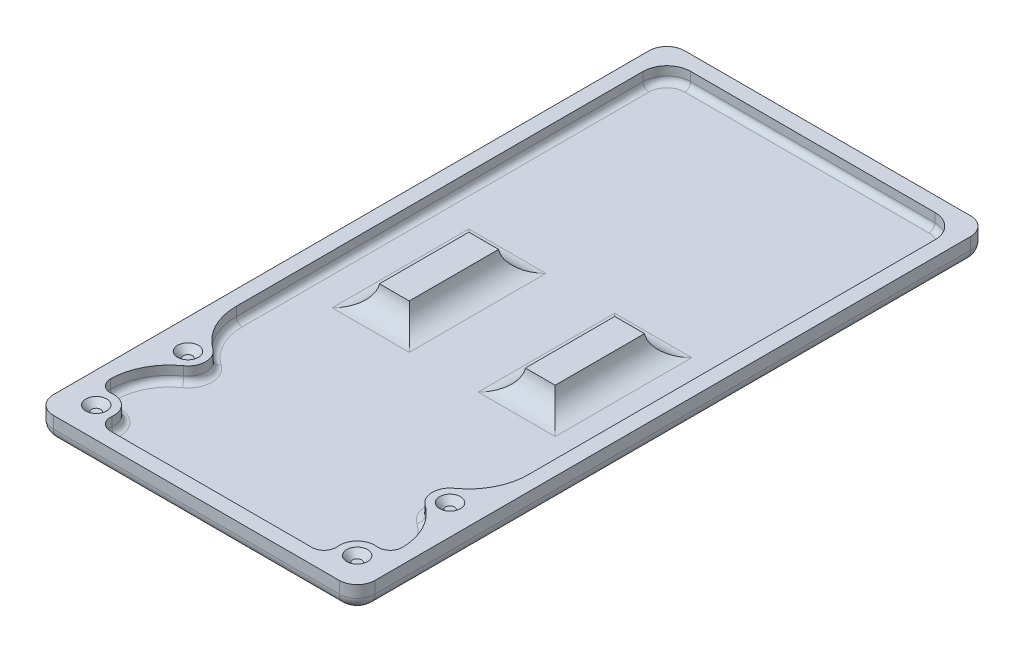
from build123d import *

# Parameters (mm, degrees)
SKETCH1_W            = 49
SKETCH1_H            = 101
BOSS_EXTRUDE1_DEPTH  = 1.5
SKETCH2_W            = 54
SKETCH2_H            = 106
SKETCH2_W_2          = 49
SKETCH2_H_2          = 101
BOSS_EXTRUDE2_DEPTH  = 4
BOSS_EXTRUDE3_DEPTH  = 4
SKETCH8_W            = 5
SKETCH8_H            = 15
BOSS_EXTRUDE4_DEPTH  = 3.5
FILLET3_R            = 4
FILLET3_OF_MIRROR1_R = 4
SKETCH4_R            = 1.75
CUT_EXTRUDE1_DEPTH   = 1
SKETCH5_R            = 1.75
CUT_EXTRUDE2_DEPTH   = 1
FILLET1_R            = 3
FILLET2_R            = 10
CHAMFER1_SIZE        = 1
CHAMFER2_SIZE        = 1
FILLET4_R            = 2
FILLET6_R            = 4
FILLET5_R            = 1
FILLET7_R            = 2


# Some blends are built 0.0001 mm under size
with BuildPart() as part:
    # Sketch1 → Boss-Extrude1 (new body)
    with BuildSketch(Plane(origin=(0, 0, 0), x_dir=(1, 0, 0), z_dir=(0, 1, 0))):
        Rectangle(SKETCH1_W, SKETCH1_H)
    extrude(amount=BOSS_EXTRUDE1_DEPTH)

    # Sketch2 → Boss-Extrude2 (add)
    with BuildSketch(Plane(origin=(0, 0, 0), x_dir=(1, 0, 0), z_dir=(0, 1, 0))):
        Rectangle(SKETCH2_W, SKETCH2_H)
        Rectangle(SKETCH2_W_2, SKETCH2_H_2, mode=Mode.SUBTRACT)
    extrude(amount=BOSS_EXTRUDE2_DEPTH)

    # Sketch3 → Boss-Extrude3 (add)
    with BuildSketch(Plane(origin=(0, 0, 0), x_dir=(1, 0, 0), z_dir=(0, 1, 0))):
        with BuildLine():
            Line((-24.5, -30.741687605), (-24.5, -34.058312395))
            ThreePointArc((-24.5, -34.058312395), (-19, -32.4), (-24.5, -30.741687605))
        make_face()
        with BuildLine():
            Line((-24.5, -46.403337045), (-24.5, -50.5))
            Line((-24.5, -50.5), (-20.403337045, -50.5))
            ThreePointArc((-20.403337045, -50.5), (-19.778679656, -45.778679656), (-24.5, -46.403337045))
        make_face()
    boss_extrude3 = extrude(amount=BOSS_EXTRUDE3_DEPTH)

    # Sketch8 → Boss-Extrude4 (add)
    with BuildSketch(Plane(origin=(0, 1.5, 0), x_dir=(1, 0, 0), z_dir=(0, 1, 0))):
        with Locations((-12.25, 0)):
            Rectangle(SKETCH8_W, SKETCH8_H)
    boss_extrude4 = extrude(amount=BOSS_EXTRUDE4_DEPTH)

    # Fillet3
    # the kernel refuses this fillet: 4 mm, written as the material it adds along each edge
    with BuildSketch(Plane(origin=(-14.75, 1.5, -7.5), x_dir=(0, 0, -1), z_dir=(1, 0, 0)), Plane(origin=(-9.75, 1.5, 7.5), x_dir=(0, 0, 1), z_dir=(-1, 0, 0))) as fillet3_piece_1:
        with BuildLine():
            CenterArc((3.968626967, 4), FILLET3_R, 187.180755781, 82.819244219)
            Line((0, 3.5), (-0.079372539, 3.49))
            ThreePointArc((-0.079372539, 3.49), (-0.08, 1.75), (-0.08, 0))
            Line((-0.08, 0), (0, -0.08))
            Line((0, -0.08), (3.968626967, -0.08))
            Line((3.968626967, -0.08), (3.968626967, 0))
        make_face()
    extrude(amount=5)
    with BuildSketch(Plane(origin=(-9.75, 1.5, -7.5), x_dir=(1, 0, 0), z_dir=(0, 0, 1)), Plane(origin=(-14.75, 1.5, 7.5), x_dir=(-1, 0, 0), z_dir=(0, 0, -1))) as fillet3_piece_2:
        with BuildLine():
            CenterArc((3.968626967, 4), FILLET3_R, 187.180755781, 82.819244219)
            Line((0, 3.5), (-0.079372539, 3.49))
            ThreePointArc((-0.079372539, 3.49), (-0.08, 1.75), (-0.08, 0))
            Line((-0.08, 0), (0, -0.08))
            Line((0, -0.08), (3.968626967, -0.08))
            Line((3.968626967, -0.08), (3.968626967, 0))
        make_face()
    extrude(amount=15)
    with BuildSketch(Plane(origin=(-14.75, 1.5, 7.5), x_dir=(-1, 0, 0), z_dir=(0, 0, -1))) as fillet3_piece_3a_section:
        with BuildLine():
            CenterArc((3.968626967, 4), FILLET3_R, 187.180755781, 82.819244219)
            Line((0, 3.5), (-0.079372539, 3.49))
            ThreePointArc((-0.079372539, 3.49), (-0.08, 1.75), (-0.08, 0))
            Line((-0.08, 0), (0, -0.08))
            Line((0, -0.08), (3.968626967, -0.08))
            Line((3.968626967, -0.08), (3.968626967, 0))
        make_face()
    fillet3_piece_3a = extrude(amount=24.921567416, mode=Mode.PRIVATE)
    fillet3_piece_3a = split(fillet3_piece_3a, bisect_by=Plane(origin=(-15.663794772, 2.350141375, -7.5), z_dir=(0, 0, -1)), keep=Keep.TOP, mode=Mode.PRIVATE)
    with BuildSketch(Plane(origin=(-24.671567416, 1.5, -7.5), x_dir=(0, 0, -1), z_dir=(1, 0, 0))) as fillet3_piece_3b_section:
        with BuildLine():
            CenterArc((3.968626967, 4), FILLET3_R, 187.180755781, 82.819244219)
            Line((0, 3.5), (-0.079372539, 3.49))
            ThreePointArc((-0.079372539, 3.49), (-0.08, 1.75), (-0.08, 0))
            Line((-0.08, 0), (0, -0.08))
            Line((0, -0.08), (3.968626967, -0.08))
            Line((3.968626967, -0.08), (3.968626967, 0))
        make_face()
    fillet3_piece_3b = extrude(amount=14.921567416, mode=Mode.PRIVATE)
    fillet3_piece_3b = split(fillet3_piece_3b, bisect_by=Plane(origin=(-14.75, 2.350141375, -8.413794772), z_dir=(-1, 0, 0)), keep=Keep.TOP, mode=Mode.PRIVATE)
    fillet3_piece_3 = fillet3_piece_3a & fillet3_piece_3b
    add(fillet3_piece_3)
    with BuildSketch(Plane(origin=(-9.75, 1.5, -17.421567416), x_dir=(1, 0, 0), z_dir=(0, 0, 1))) as fillet3_piece_4a_section:
        with BuildLine():
            CenterArc((3.968626967, 4), FILLET3_R, 187.180755781, 82.819244219)
            Line((0, 3.5), (-0.079372539, 3.49))
            ThreePointArc((-0.079372539, 3.49), (-0.08, 1.75), (-0.08, 0))
            Line((-0.08, 0), (0, -0.08))
            Line((0, -0.08), (3.968626967, -0.08))
            Line((3.968626967, -0.08), (3.968626967, 0))
        make_face()
    fillet3_piece_4a = extrude(amount=24.921567416, mode=Mode.PRIVATE)
    fillet3_piece_4a = split(fillet3_piece_4a, bisect_by=Plane(origin=(-8.836205228, 2.350141375, -7.5), z_dir=(0, 0, -1)), keep=Keep.TOP, mode=Mode.PRIVATE)
    with BuildSketch(Plane(origin=(-14.75, 1.5, -7.5), x_dir=(0, 0, -1), z_dir=(1, 0, 0))) as fillet3_piece_4b_section:
        with BuildLine():
            CenterArc((3.968626967, 4), FILLET3_R, 187.180755781, 82.819244219)
            Line((0, 3.5), (-0.079372539, 3.49))
            ThreePointArc((-0.079372539, 3.49), (-0.08, 1.75), (-0.08, 0))
            Line((-0.08, 0), (0, -0.08))
            Line((0, -0.08), (3.968626967, -0.08))
            Line((3.968626967, -0.08), (3.968626967, 0))
        make_face()
    fillet3_piece_4b = extrude(amount=14.921567416, mode=Mode.PRIVATE)
    fillet3_piece_4b = split(fillet3_piece_4b, bisect_by=Plane(origin=(-9.75, 2.350141375, -8.413794772), z_dir=(1, 0, 0)), keep=Keep.TOP, mode=Mode.PRIVATE)
    fillet3_piece_4 = fillet3_piece_4a & fillet3_piece_4b
    add(fillet3_piece_4)
    with BuildSketch(Plane(origin=(0.171567416, 1.5, 7.5), x_dir=(0, 0, 1), z_dir=(-1, 0, 0))) as fillet3_piece_5a_section:
        with BuildLine():
            CenterArc((3.968626967, 4), FILLET3_R, 187.180755781, 82.819244219)
            Line((0, 3.5), (-0.079372539, 3.49))
            ThreePointArc((-0.079372539, 3.49), (-0.08, 1.75), (-0.08, 0))
            Line((-0.08, 0), (0, -0.08))
            Line((0, -0.08), (3.968626967, -0.08))
            Line((3.968626967, -0.08), (3.968626967, 0))
        make_face()
    fillet3_piece_5a = extrude(amount=14.921567416, mode=Mode.PRIVATE)
    fillet3_piece_5a = split(fillet3_piece_5a, bisect_by=Plane(origin=(-9.75, 2.350141375, 8.413794772), z_dir=(1, 0, 0)), keep=Keep.TOP, mode=Mode.PRIVATE)
    with BuildSketch(Plane(origin=(-9.75, 1.5, -7.5), x_dir=(1, 0, 0), z_dir=(0, 0, 1))) as fillet3_piece_5b_section:
        with BuildLine():
            CenterArc((3.968626967, 4), FILLET3_R, 187.180755781, 82.819244219)
            Line((0, 3.5), (-0.079372539, 3.49))
            ThreePointArc((-0.079372539, 3.49), (-0.08, 1.75), (-0.08, 0))
            Line((-0.08, 0), (0, -0.08))
            Line((0, -0.08), (3.968626967, -0.08))
            Line((3.968626967, -0.08), (3.968626967, 0))
        make_face()
    fillet3_piece_5b = extrude(amount=24.921567416, mode=Mode.PRIVATE)
    fillet3_piece_5b = split(fillet3_piece_5b, bisect_by=Plane(origin=(-8.836205228, 2.350141375, 7.5), z_dir=(0, 0, 1)), keep=Keep.TOP, mode=Mode.PRIVATE)
    fillet3_piece_5 = fillet3_piece_5a & fillet3_piece_5b
    add(fillet3_piece_5)
    with BuildSketch(Plane(origin=(-14.75, 1.5, 17.421567416), x_dir=(-1, 0, 0), z_dir=(0, 0, -1))) as fillet3_piece_6a_section:
        with BuildLine():
            CenterArc((3.968626967, 4), FILLET3_R, 187.180755781, 82.819244219)
            Line((0, 3.5), (-0.079372539, 3.49))
            ThreePointArc((-0.079372539, 3.49), (-0.08, 1.75), (-0.08, 0))
            Line((-0.08, 0), (0, -0.08))
            Line((0, -0.08), (3.968626967, -0.08))
            Line((3.968626967, -0.08), (3.968626967, 0))
        make_face()
    fillet3_piece_6a = extrude(amount=24.921567416, mode=Mode.PRIVATE)
    fillet3_piece_6a = split(fillet3_piece_6a, bisect_by=Plane(origin=(-15.663794772, 2.350141375, 7.5), z_dir=(0, 0, 1)), keep=Keep.TOP, mode=Mode.PRIVATE)
    with BuildSketch(Plane(origin=(-9.75, 1.5, 7.5), x_dir=(0, 0, 1), z_dir=(-1, 0, 0))) as fillet3_piece_6b_section:
        with BuildLine():
            CenterArc((3.968626967, 4), FILLET3_R, 187.180755781, 82.819244219)
            Line((0, 3.5), (-0.079372539, 3.49))
            ThreePointArc((-0.079372539, 3.49), (-0.08, 1.75), (-0.08, 0))
            Line((-0.08, 0), (0, -0.08))
            Line((0, -0.08), (3.968626967, -0.08))
            Line((3.968626967, -0.08), (3.968626967, 0))
        make_face()
    fillet3_piece_6b = extrude(amount=14.921567416, mode=Mode.PRIVATE)
    fillet3_piece_6b = split(fillet3_piece_6b, bisect_by=Plane(origin=(-14.75, 2.350141375, 8.413794772), z_dir=(-1, 0, 0)), keep=Keep.TOP, mode=Mode.PRIVATE)
    fillet3_piece_6 = fillet3_piece_6a & fillet3_piece_6b
    add(fillet3_piece_6)

    # Mirror1: Boss-Extrude3, Boss-Extrude4 across plane
    add(boss_extrude3.mirror(Plane(origin=(0, 0, 0), x_dir=(0, 0, 1), z_dir=(1, 0, 0))))
    add(boss_extrude4.mirror(Plane(origin=(0, 0, 0), x_dir=(0, 0, 1), z_dir=(1, 0, 0))))

    # Fillet3 of Mirror1
    # the kernel refuses this fillet: 4 mm, written as the material it adds along each edge
    with BuildSketch(Plane(origin=(14.75, 1.5, -7.5), x_dir=(0, 0, -1), z_dir=(-1, 0, 0)), Plane(origin=(9.75, 1.5, 7.5), x_dir=(0, 0, 1), z_dir=(1, 0, 0))) as fillet3_of_mirror1_piece_1:
        with BuildLine():
            CenterArc((3.968626967, -4), FILLET3_OF_MIRROR1_R, 90, 82.819244219)
            Line((0, -3.5), (-0.079372539, -3.49))
            ThreePointArc((-0.079372539, -3.49), (-0.08, -1.75), (-0.08, 0))
            Line((-0.08, 0), (0, 0.08))
            Line((0, 0.08), (3.968626967, 0.08))
            Line((3.968626967, 0.08), (3.968626967, 0))
        make_face()
    extrude(amount=5)
    with BuildSketch(Plane(origin=(9.75, 1.5, -7.5), x_dir=(-1, 0, 0), z_dir=(0, 0, 1)), Plane(origin=(14.75, 1.5, 7.5), x_dir=(1, 0, 0), z_dir=(0, 0, -1))) as fillet3_of_mirror1_piece_2:
        with BuildLine():
            CenterArc((3.968626967, -4), FILLET3_OF_MIRROR1_R, 90, 82.819244219)
            Line((0, -3.5), (-0.079372539, -3.49))
            ThreePointArc((-0.079372539, -3.49), (-0.08, -1.75), (-0.08, 0))
            Line((-0.08, 0), (0, 0.08))
            Line((0, 0.08), (3.968626967, 0.08))
            Line((3.968626967, 0.08), (3.968626967, 0))
        make_face()
    extrude(amount=15)
    with BuildSketch(Plane(origin=(24.671567416, 1.5, -7.5), x_dir=(0, 0, -1), z_dir=(-1, 0, 0))) as fillet3_of_mirror1_piece_3a_section:
        with BuildLine():
            CenterArc((3.968626967, -4), FILLET3_OF_MIRROR1_R, 90, 82.819244219)
            Line((0, -3.5), (-0.079372539, -3.49))
            ThreePointArc((-0.079372539, -3.49), (-0.08, -1.75), (-0.08, 0))
            Line((-0.08, 0), (0, 0.08))
            Line((0, 0.08), (3.968626967, 0.08))
            Line((3.968626967, 0.08), (3.968626967, 0))
        make_face()
    fillet3_of_mirror1_piece_3a = extrude(amount=14.921567416, mode=Mode.PRIVATE)
    fillet3_of_mirror1_piece_3a = split(fillet3_of_mirror1_piece_3a, bisect_by=Plane(origin=(14.75, 2.350141375, -8.413794772), z_dir=(1, 0, 0)), keep=Keep.TOP, mode=Mode.PRIVATE)
    with BuildSketch(Plane(origin=(14.75, 1.5, 7.5), x_dir=(1, 0, 0), z_dir=(0, 0, -1))) as fillet3_of_mirror1_piece_3b_section:
        with BuildLine():
            CenterArc((3.968626967, -4), FILLET3_OF_MIRROR1_R, 90, 82.819244219)
            Line((0, -3.5), (-0.079372539, -3.49))
            ThreePointArc((-0.079372539, -3.49), (-0.08, -1.75), (-0.08, 0))
            Line((-0.08, 0), (0, 0.08))
            Line((0, 0.08), (3.968626967, 0.08))
            Line((3.968626967, 0.08), (3.968626967, 0))
        make_face()
    fillet3_of_mirror1_piece_3b = extrude(amount=24.921567416, mode=Mode.PRIVATE)
    fillet3_of_mirror1_piece_3b = split(fillet3_of_mirror1_piece_3b, bisect_by=Plane(origin=(15.663794772, 2.350141375, -7.5), z_dir=(0, 0, -1)), keep=Keep.TOP, mode=Mode.PRIVATE)
    fillet3_of_mirror1_piece_3 = fillet3_of_mirror1_piece_3a & fillet3_of_mirror1_piece_3b
    add(fillet3_of_mirror1_piece_3)
    with BuildSketch(Plane(origin=(14.75, 1.5, -7.5), x_dir=(0, 0, -1), z_dir=(-1, 0, 0))) as fillet3_of_mirror1_piece_4a_section:
        with BuildLine():
            CenterArc((3.968626967, -4), FILLET3_OF_MIRROR1_R, 90, 82.819244219)
            Line((0, -3.5), (-0.079372539, -3.49))
            ThreePointArc((-0.079372539, -3.49), (-0.08, -1.75), (-0.08, 0))
            Line((-0.08, 0), (0, 0.08))
            Line((0, 0.08), (3.968626967, 0.08))
            Line((3.968626967, 0.08), (3.968626967, 0))
        make_face()
    fillet3_of_mirror1_piece_4a = extrude(amount=14.921567416, mode=Mode.PRIVATE)
    fillet3_of_mirror1_piece_4a = split(fillet3_of_mirror1_piece_4a, bisect_by=Plane(origin=(9.75, 2.350141375, -8.413794772), z_dir=(-1, 0, 0)), keep=Keep.TOP, mode=Mode.PRIVATE)
    with BuildSketch(Plane(origin=(9.75, 1.5, -17.421567416), x_dir=(-1, 0, 0), z_dir=(0, 0, 1))) as fillet3_of_mirror1_piece_4b_section:
        with BuildLine():
            CenterArc((3.968626967, -4), FILLET3_OF_MIRROR1_R, 90, 82.819244219)
            Line((0, -3.5), (-0.079372539, -3.49))
            ThreePointArc((-0.079372539, -3.49), (-0.08, -1.75), (-0.08, 0))
            Line((-0.08, 0), (0, 0.08))
            Line((0, 0.08), (3.968626967, 0.08))
            Line((3.968626967, 0.08), (3.968626967, 0))
        make_face()
    fillet3_of_mirror1_piece_4b = extrude(amount=24.921567416, mode=Mode.PRIVATE)
    fillet3_of_mirror1_piece_4b = split(fillet3_of_mirror1_piece_4b, bisect_by=Plane(origin=(8.836205228, 2.350141375, -7.5), z_dir=(0, 0, -1)), keep=Keep.TOP, mode=Mode.PRIVATE)
    fillet3_of_mirror1_piece_4 = fillet3_of_mirror1_piece_4a & fillet3_of_mirror1_piece_4b
    add(fillet3_of_mirror1_piece_4)
    with BuildSketch(Plane(origin=(9.75, 1.5, -7.5), x_dir=(-1, 0, 0), z_dir=(0, 0, 1))) as fillet3_of_mirror1_piece_5a_section:
        with BuildLine():
            CenterArc((3.968626967, -4), FILLET3_OF_MIRROR1_R, 90, 82.819244219)
            Line((0, -3.5), (-0.079372539, -3.49))
            ThreePointArc((-0.079372539, -3.49), (-0.08, -1.75), (-0.08, 0))
            Line((-0.08, 0), (0, 0.08))
            Line((0, 0.08), (3.968626967, 0.08))
            Line((3.968626967, 0.08), (3.968626967, 0))
        make_face()
    fillet3_of_mirror1_piece_5a = extrude(amount=24.921567416, mode=Mode.PRIVATE)
    fillet3_of_mirror1_piece_5a = split(fillet3_of_mirror1_piece_5a, bisect_by=Plane(origin=(8.836205228, 2.350141375, 7.5), z_dir=(0, 0, 1)), keep=Keep.TOP, mode=Mode.PRIVATE)
    with BuildSketch(Plane(origin=(-0.171567416, 1.5, 7.5), x_dir=(0, 0, 1), z_dir=(1, 0, 0))) as fillet3_of_mirror1_piece_5b_section:
        with BuildLine():
            CenterArc((3.968626967, -4), FILLET3_OF_MIRROR1_R, 90, 82.819244219)
            Line((0, -3.5), (-0.079372539, -3.49))
            ThreePointArc((-0.079372539, -3.49), (-0.08, -1.75), (-0.08, 0))
            Line((-0.08, 0), (0, 0.08))
            Line((0, 0.08), (3.968626967, 0.08))
            Line((3.968626967, 0.08), (3.968626967, 0))
        make_face()
    fillet3_of_mirror1_piece_5b = extrude(amount=14.921567416, mode=Mode.PRIVATE)
    fillet3_of_mirror1_piece_5b = split(fillet3_of_mirror1_piece_5b, bisect_by=Plane(origin=(9.75, 2.350141375, 8.413794772), z_dir=(-1, 0, 0)), keep=Keep.TOP, mode=Mode.PRIVATE)
    fillet3_of_mirror1_piece_5 = fillet3_of_mirror1_piece_5a & fillet3_of_mirror1_piece_5b
    add(fillet3_of_mirror1_piece_5)
    with BuildSketch(Plane(origin=(9.75, 1.5, 7.5), x_dir=(0, 0, 1), z_dir=(1, 0, 0))) as fillet3_of_mirror1_piece_6a_section:
        with BuildLine():
            CenterArc((3.968626967, -4), FILLET3_OF_MIRROR1_R, 90, 82.819244219)
            Line((0, -3.5), (-0.079372539, -3.49))
            ThreePointArc((-0.079372539, -3.49), (-0.08, -1.75), (-0.08, 0))
            Line((-0.08, 0), (0, 0.08))
            Line((0, 0.08), (3.968626967, 0.08))
            Line((3.968626967, 0.08), (3.968626967, 0))
        make_face()
    fillet3_of_mirror1_piece_6a = extrude(amount=14.921567416, mode=Mode.PRIVATE)
    fillet3_of_mirror1_piece_6a = split(fillet3_of_mirror1_piece_6a, bisect_by=Plane(origin=(14.75, 2.350141375, 8.413794772), z_dir=(1, 0, 0)), keep=Keep.TOP, mode=Mode.PRIVATE)
    with BuildSketch(Plane(origin=(14.75, 1.5, 17.421567416), x_dir=(1, 0, 0), z_dir=(0, 0, -1))) as fillet3_of_mirror1_piece_6b_section:
        with BuildLine():
            CenterArc((3.968626967, -4), FILLET3_OF_MIRROR1_R, 90, 82.819244219)
            Line((0, -3.5), (-0.079372539, -3.49))
            ThreePointArc((-0.079372539, -3.49), (-0.08, -1.75), (-0.08, 0))
            Line((-0.08, 0), (0, 0.08))
            Line((0, 0.08), (3.968626967, 0.08))
            Line((3.968626967, 0.08), (3.968626967, 0))
        make_face()
    fillet3_of_mirror1_piece_6b = extrude(amount=24.921567416, mode=Mode.PRIVATE)
    fillet3_of_mirror1_piece_6b = split(fillet3_of_mirror1_piece_6b, bisect_by=Plane(origin=(15.663794772, 2.350141375, 7.5), z_dir=(0, 0, 1)), keep=Keep.TOP, mode=Mode.PRIVATE)
    fillet3_of_mirror1_piece_6 = fillet3_of_mirror1_piece_6a & fillet3_of_mirror1_piece_6b
    add(fillet3_of_mirror1_piece_6)

    # Sketch4 → Cut-Extrude1 (cut)
    with BuildSketch(Plane(origin=(0, 4, 0), x_dir=(1, 0, 0), z_dir=(0, 1, 0))):
        with Locations(Location((-21.9, -47.9, 0), (0, 0, 270))):
            Circle(SKETCH4_R)
        with Locations(Location((21.9, -47.9, 0), (0, 0, 270))):
            Circle(SKETCH4_R)
    extrude(amount=-CUT_EXTRUDE1_DEPTH, mode=Mode.SUBTRACT)

    # Sketch5 → Cut-Extrude2 (cut)
    with BuildSketch(Plane(origin=(0, 4, 0), x_dir=(1, 0, 0), z_dir=(0, 1, 0))):
        with Locations(Location((-22, -32.4, 0), (0, 0, 270))):
            Circle(SKETCH5_R)
        with Locations(Location((22, -32.4, 0), (0, 0, 270))):
            Circle(SKETCH5_R)
    extrude(amount=-CUT_EXTRUDE2_DEPTH, mode=Mode.SUBTRACT)

    # Fillet1
    fillet1_edges = [part.edges().sort_by_distance(p)[0] for p in [
        (-27, 2, 53),
        (27, 2, 53),
        (27, 2, -53),
        (-27, 2, -53),
    ]]
    fillet(fillet1_edges, radius=FILLET1_R)

    # Fillet2
    fillet2_edges = [part.edges().sort_by_distance(p)[0] for p in [
        (24.5, 2.75, 34.058312395),
        (24.5, 2.75, 30.741687605),
        (-24.5, 2.75, 34.058312395),
        (-24.5, 2.75, 30.741687605),
    ]]
    fillet(fillet2_edges, radius=FILLET2_R)

    # Chamfer1
    chamfer1_edges = [part.edges().sort_by_distance(p)[0] for p in [
        (-22, 3, 30.65),
        (22, 3, 30.65),
    ]]
    chamfer(chamfer1_edges, length=CHAMFER1_SIZE - 0.0001)  # a hair under: the kernel refuses the full size

    # Chamfer2
    chamfer2_edges = [part.edges().sort_by_distance(p)[0] for p in [
        (-21.9, 3, 46.15),
        (21.9, 3, 46.15),
    ]]
    chamfer(chamfer2_edges, length=CHAMFER2_SIZE - 0.0001)  # a hair under: the kernel refuses the full size

    # Fillet4
    fillet4_edges = [part.edges().sort_by_distance(p)[0] for p in [
        (24.5, 2.75, 46.403337045),
        (20.403337045, 2.75, 50.5),
        (-20.403337045, 2.75, 50.5),
        (-24.5, 2.75, 46.403337045),
    ]]
    fillet(fillet4_edges, radius=FILLET4_R)

    # Fillet6
    fillet6_edges = [part.edges().sort_by_distance(p)[0] for p in [
        (24.5, 2.75, -50.5),
        (-24.5, 2.75, -50.5),
    ]]
    fillet(fillet6_edges, radius=FILLET6_R)

    # Fillet5
    fillet5_edges = [part.edges().sort_by_distance(p)[0] for p in [
        (19, 1.5, 32.4),
        (24.5, 1.5, -12.359190145),
        (-19, 1.5, 32.4),
        (-23.355759821, 1.5, 38.373434867),
        (-23.379535677, 1.5, 26.380950764),
        (23.379535677, 1.5, 26.380950764),
        (19.778589199, 1.5, 45.778770118),
        (-19.778589199, 1.5, 45.778770118),
        (0, 1.5, 50.5),
        (23.355759821, 1.5, 38.373434867),
        (-23.833971189, 1.5, 44.42584152),
        (-18.432793496, 1.5, 49.826649916),
        (18.432793496, 1.5, 49.826649916),
        (23.833971189, 1.5, 44.42584152),
        (0, 1.5, -50.5),
        (-24.5, 1.5, -12.359190145),
        (-23.328427125, 1.5, -49.328427125),
        (23.328427125, 1.5, -49.328427125),
    ]]
    fillet(fillet5_edges, radius=FILLET5_R)

    # Fillet7
    fillet7_edges = [part.edges().sort_by_distance(p)[0] for p in [
        (0, 0, 53),
        (-27, 0, 0),
        (0, 0, -53),
        (27, 0, 0),
        (-26.121320344, 0, -52.121320344),
        (26.121320344, 0, -52.121320344),
        (26.121320344, 0, 52.121320344),
        (-26.121320344, 0, 52.121320344),
    ]]
    fillet(fillet7_edges, radius=FILLET7_R)


solid = part.part
